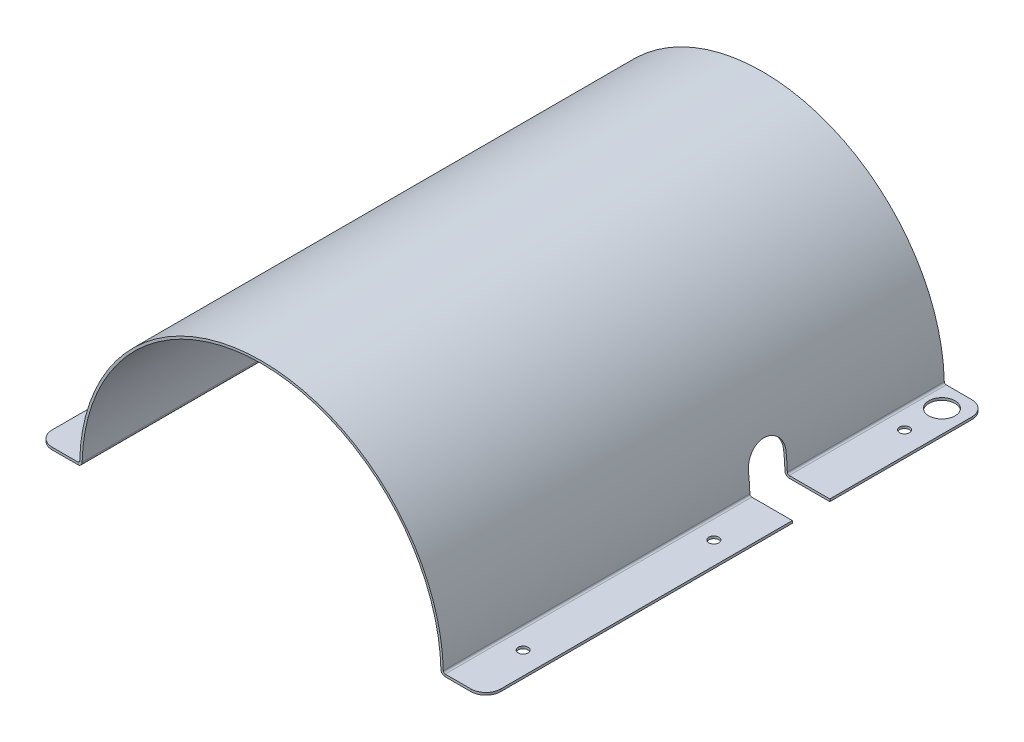
from build123d import *

# Parameters (mm, degrees)
BASE_FLANGE1_DEPTH = 212.725
FILLET1_R          = 6.35
SKETCH3_R          = 5.5626
SKETCH3_R_2        = 2.1082
CUT_EXTRUDE1_DEPTH = 7.62
CUT_EXTRUDE2_DEPTH = 246.533701925


# Read off the part's stored shape, not the designer's step: Base-Flange1
with BuildPart() as part:
    # Base-Flange1 outline → Base-Flange1 (new body)
    with BuildSketch(Plane.XY):
        with BuildLine():
            Line((-78.007365806, 1.016), (-95.25, 1.016))
            Line((-95.25, 1.016), (-95.25, 0))
            Line((-95.25, 0), (-78.007365806, 0))
            ThreePointArc((-78.007365806, 0), (-76.729452957, 0.520576705), (-76.17906817, 1.7859375))
            ThreePointArc((-76.17906817, 1.7859375), (0, 76.2), (76.17906817, 1.7859375))
            ThreePointArc((76.17906817, 1.7859375), (76.729452957, 0.520576705), (78.007365806, 0))
            Line((78.007365806, 0), (95.25, 0))
            Line((95.25, 0), (95.25, 1.016))
            Line((95.25, 1.016), (78.007365806, 1.016))
            ThreePointArc((78.007365806, 1.016), (77.43940454, 1.247367424), (77.194789079, 1.80975))
            ThreePointArc((77.194789079, 1.80975), (0, 77.216), (-77.194789079, 1.80975))
            ThreePointArc((-77.194789079, 1.80975), (-77.43940454, 1.247367424), (-78.007365806, 1.016))
        make_face()
    extrude(amount=BASE_FLANGE1_DEPTH)

    # Fillet1
    fillet1_edges = [part.edges().sort_by_distance(p)[0] for p in [
        (95.25, 0.508, 0),
        (-95.25, 0.508, 0),
        (95.25, 0.508, 212.725),
        (-95.25, 0.508, 212.725),
    ]]
    fillet(fillet1_edges, radius=FILLET1_R)

    # Sketch3 → Cut-Extrude1 (cut)
    with BuildSketch(Plane.XZ):
        with Locations((-85.725, 9.525)):
            Circle(SKETCH3_R)
        with Locations((-85.725, 25.4)):
            Circle(SKETCH3_R_2)
        with Locations((-85.725, 106.3752)):
            Circle(SKETCH3_R_2)
        with Locations((-85.725, 187.3504)):
            Circle(SKETCH3_R_2)
        with Locations((85.725, 9.525)):
            Circle(SKETCH3_R)
        with Locations((85.725, 25.4)):
            Circle(SKETCH3_R_2)
        with Locations((85.725, 106.3752)):
            Circle(SKETCH3_R_2)
        with Locations((85.725, 187.3504)):
            Circle(SKETCH3_R_2)
    extrude(amount=-CUT_EXTRUDE1_DEPTH, mode=Mode.SUBTRACT)

    # Sketch4 → Cut-Extrude2 (cut, through all)
    with BuildSketch(Plane(origin=(0, 0, 0), x_dir=(0, 0, -1), z_dir=(1, 0, 0))):
        with BuildLine():
            Line((-82.5627, -6.3754), (-82.5627, 9.525))
            ThreePointArc((-82.5627, 9.525), (-74.6125, 17.4752), (-66.6623, 9.525))
            Line((-66.6623, 9.525), (-66.6623, -6.3754))
            Line((-66.6623, -6.3754), (-82.5627, -6.3754))
        make_face()
    extrude(amount=CUT_EXTRUDE2_DEPTH, mode=Mode.SUBTRACT)


solid = part.part
